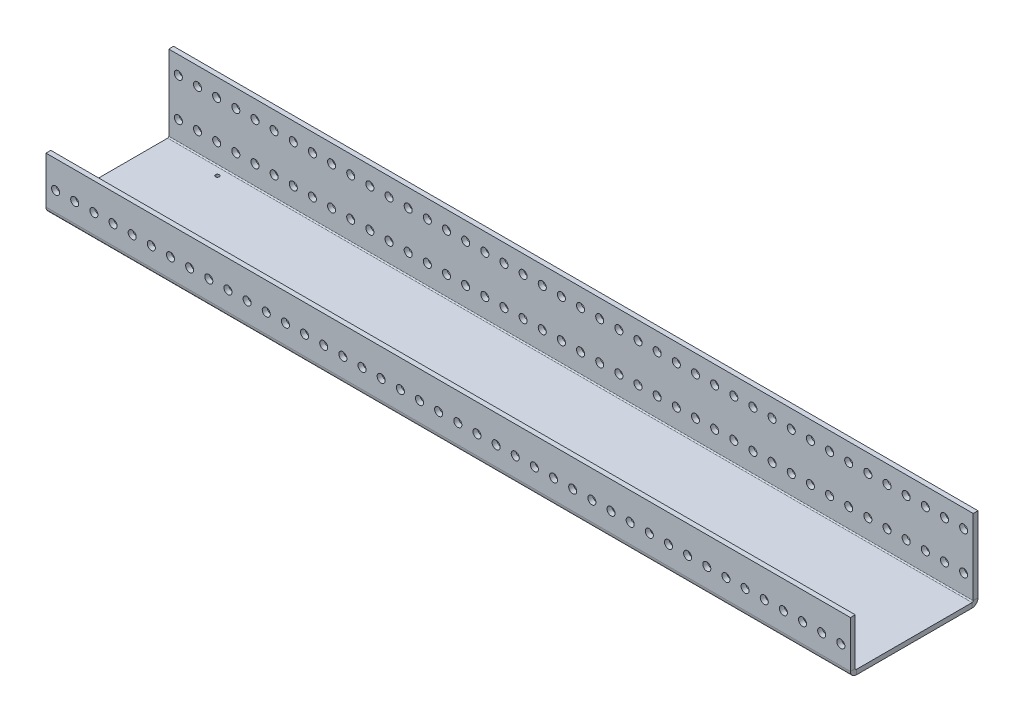
from build123d import *

# Parameters (mm, degrees)
SKETCH1_W                    = 787.4
SKETCH1_H                    = 78.232
BOSS_EXTRUDE1_DEPTH          = 3.175
EDGE_FLANGE1_STRIP_W         = 14.224
EDGE_FLANGE1_STRIP_H         = 3.175
EDGE_FLANGE1_STRIP_CUT_DEPTH = 787.4
EDGE_FLANGE1_DEPTH           = 787.4
EDGE_FLANGE2_STRIP_W         = 14.224
EDGE_FLANGE2_STRIP_H         = 3.175
EDGE_FLANGE2_STRIP_CUT_DEPTH = 787.4
EDGE_FLANGE2_DEPTH           = 787.4
SKETCH9_R                    = 2.667
CUT_EXTRUDE1_DEPTH           = 794.767078776
CHAMFER1_SIZE                = 3.175
LPATTERN1_COUNT              = 62
LPATTERN1_PITCH              = 12.7
SKETCH12_R                   = 1.27
CUT_EXTRUDE4_DEPTH           = 794.225377588
SKETCH14_R                   = 2.667
CUT_EXTRUDE6_DEPTH           = 5.08
LPATTERN4_COUNT              = 62
LPATTERN4_PITCH              = 12.7
CUT_EXTRUDE7_DEPTH           = 794.225377588
CUT_EXTRUDE7_DEPTH_BACK      = 794.225377588
SKETCH16_W                   = 96.999244771
SKETCH16_H                   = 62.050987464
CUT_EXTRUDE11_DEPTH          = 630.918796571
SKETCH17_W                   = 96.999244771
SKETCH17_H                   = 62.050987464
CUT_EXTRUDE12_DEPTH          = 543.269269159


# Sheet-metal steps are written as plain solids
with BuildPart() as part:
    # Sketch1 → Boss-Extrude1 (new body)
    with BuildSketch(Plane(origin=(0, 0, 0), x_dir=(1, 0, 0), z_dir=(0, 1, 0))):
        with Locations((393.7, 39.116)):
            Rectangle(SKETCH1_W, SKETCH1_H)
    extrude(amount=BOSS_EXTRUDE1_DEPTH)

    # Edge-Flange1 strip (across the edge) → Edge-Flange1 strip cut (cut)
    with BuildSketch(Plane(origin=(787.4, 3.175, -78.232), x_dir=(0, 0, 1), z_dir=(-1, 0, 0))):
        with Locations((-6.35, -1.5875)):
            Rectangle(EDGE_FLANGE1_STRIP_W, EDGE_FLANGE1_STRIP_H)
    extrude(amount=EDGE_FLANGE1_STRIP_CUT_DEPTH, mode=Mode.SUBTRACT)

    # Edge-Flange1 section (across the edge) → Edge-Flange1 (add)
    with BuildSketch(Plane(origin=(787.4, 3.175, -78.232), x_dir=(0, 0, 1), z_dir=(-1, 0, 0))):
        with BuildLine():
            Line((-3.175, 0.762), (-3.175, 50.8))
            Line((-3.175, 50.8), (0, 50.8))
            Line((0, 50.8), (0, 0.762))
            ThreePointArc((0, 0.762), (0.223184633, 0.223184633), (0.762, 0))
            Line((0.762, 0), (0.762, -3.175))
            ThreePointArc((0.762, -3.175), (-2.021879398, -2.021879398), (-3.175, 0.762))
        make_face()
    extrude(amount=EDGE_FLANGE1_DEPTH)

    # Edge-Flange2 strip (across the edge) → Edge-Flange2 strip cut (cut)
    with BuildSketch(Plane(origin=(0, 3.175, 0), x_dir=(0, 0, -1), z_dir=(1, 0, 0))):
        with Locations((-6.35, -1.5875)):
            Rectangle(EDGE_FLANGE2_STRIP_W, EDGE_FLANGE2_STRIP_H)
    extrude(amount=EDGE_FLANGE2_STRIP_CUT_DEPTH, mode=Mode.SUBTRACT)

    # Edge-Flange2 section (across the edge) → Edge-Flange2 (add)
    with BuildSketch(Plane(origin=(0, 3.175, 0), x_dir=(0, 0, -1), z_dir=(1, 0, 0))):
        with BuildLine():
            Line((-3.175, 0.762), (-3.175, 31.75))
            Line((-3.175, 31.75), (0, 31.75))
            Line((0, 31.75), (0, 0.762))
            ThreePointArc((0, 0.762), (0.223184633, 0.223184633), (0.762, 0))
            Line((0.762, 0), (0.762, -3.175))
            ThreePointArc((0.762, -3.175), (-2.021879398, -2.021879398), (-3.175, 0.762))
        make_face()
    extrude(amount=EDGE_FLANGE2_DEPTH)

    # Sketch9 → Cut-Extrude1 (cut, through all)
    with BuildSketch(Plane.XY.offset(3.175)):
        with Locations((781.05, 16.637)):
            Circle(SKETCH9_R)
    cut_extrude1 = extrude(amount=-CUT_EXTRUDE1_DEPTH, mode=Mode.SUBTRACT)

    # Chamfer1
    chamfer1_edges = [part.edges().sort_by_distance(p)[0] for p in [
        (787.4, 53.975, -79.8195),
        (0, 53.975, -79.8195),
        (0, 34.925, 1.5875),
        (787.4, 34.925, 1.5875),
    ]]
    chamfer(chamfer1_edges, length=CHAMFER1_SIZE)

    # LPattern1: Cut-Extrude1 ×62
    with Locations(*[(-i * LPATTERN1_PITCH, 0, 0) for i in range(1, LPATTERN1_COUNT)]):
        add(cut_extrude1, mode=Mode.SUBTRACT)

    # Sketch12 → Cut-Extrude4 (cut, through all)
    with BuildSketch(Plane(origin=(0, 3.175, 0), x_dir=(1, 0, 0), z_dir=(0, 1, 0))):
        with Locations(Location((101.6, 72.39, 0), (0, 0, 270))):
            Circle(SKETCH12_R)
        with Locations(Location((203.2, 72.39, 0), (0, 0, 270))):
            Circle(SKETCH12_R)
        with Locations(Location((203.2, 5.842, 0), (0, 0, 270))):
            Circle(SKETCH12_R)
        with Locations(Location((101.6, 5.842, 0), (0, 0, 270))):
            Circle(SKETCH12_R)
    extrude(amount=-CUT_EXTRUDE4_DEPTH, mode=Mode.SUBTRACT)

    # Sketch14 → Cut-Extrude6 (cut)
    with BuildSketch(Plane(origin=(0, 0, -81.407), x_dir=(-1, 0, 0), z_dir=(0, 0, -1))):
        with Locations(Location((-781.05, 42.037, 0), (0, 0, 90))):
            Circle(SKETCH14_R)
    cut_extrude6 = extrude(amount=-CUT_EXTRUDE6_DEPTH, mode=Mode.SUBTRACT)

    # LPattern4: Cut-Extrude6 ×62
    with Locations(*[(-i * LPATTERN4_PITCH, 0, 0) for i in range(1, LPATTERN4_COUNT)]):
        add(cut_extrude6, mode=Mode.SUBTRACT)

    # Sketch15 → Cut-Extrude7 (cut, two sides: drawn at the far end of the back side and taken through both)
    with BuildSketch(Plane(origin=(0, 3.175, 0), x_dir=(1, 0, 0), z_dir=(0, 1, 0)).offset(-CUT_EXTRUDE7_DEPTH_BACK)):
        Polygon((101.6, 5.842), (101.6, 72.39), (101.6, 81.407), (0, 81.407), (0, -3.175), (101.6, -3.175), align=None)
    extrude(amount=CUT_EXTRUDE7_DEPTH + CUT_EXTRUDE7_DEPTH_BACK, mode=Mode.SUBTRACT)

    # Sketch16 → Cut-Extrude11 (cut, through all)
    with BuildSketch(Plane.ZY.offset(-165.1)):
        with Locations((-39.370455122, 27.727518157)):
            Rectangle(SKETCH16_W, SKETCH16_H)
    extrude(amount=CUT_EXTRUDE11_DEPTH, mode=Mode.SUBTRACT)

    # Sketch17 → Cut-Extrude12 (cut, through all)
    with BuildSketch(Plane(origin=(698.5, 0, 0), x_dir=(0, 0, -1), z_dir=(1, 0, 0))):
        with Locations((39.370455122, 27.727518157)):
            Rectangle(SKETCH17_W, SKETCH17_H)
    extrude(amount=CUT_EXTRUDE12_DEPTH, mode=Mode.SUBTRACT)


solid = part.part
